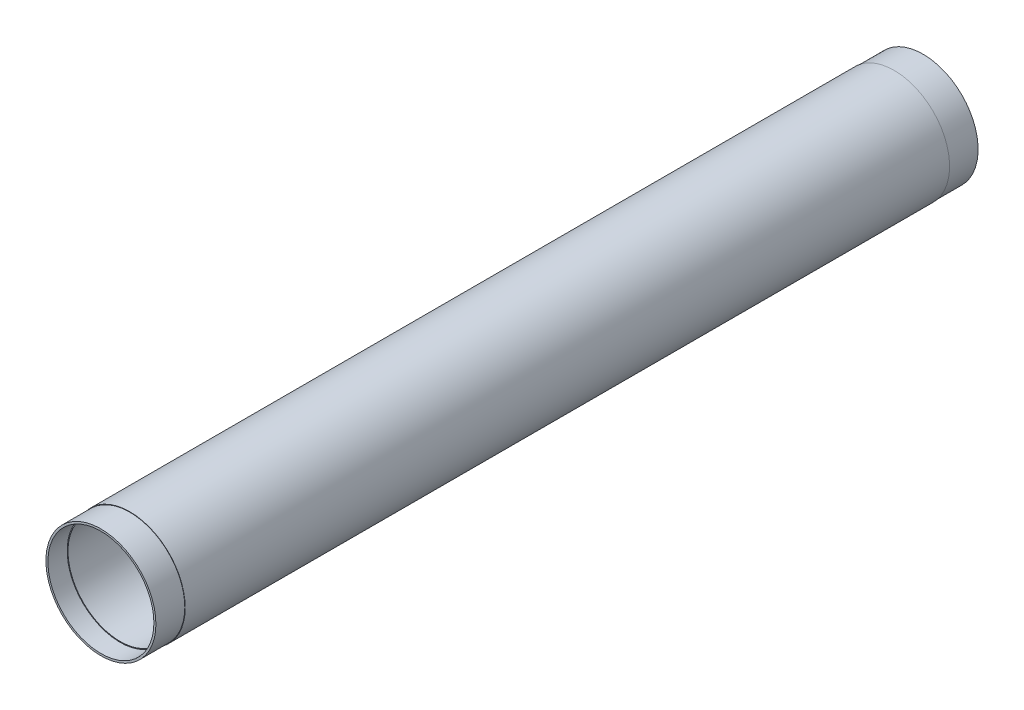
from build123d import *

# Parameters (mm, degrees)
SKETCH1_R           = 34.5
SKETCH1_R_2         = 32.5
BOSS_EXTRUDE1_DEPTH = 512
CUT_EXTRUDE1_START  = -12
SKETCH3_R           = 33
SKETCH3_R_2         = 32.5
CUT_EXTRUDE1_DEPTH  = 12
CUT_EXTRUDE3_START  = -18
SKETCH4_R           = 34.5
SKETCH4_R_2         = 34.25
CUT_EXTRUDE3_DEPTH  = 18
SKETCH5_R           = 34.5
SKETCH5_R_2         = 34.25
CUT_EXTRUDE4_DEPTH  = 18


with BuildPart() as part:
    # Sketch1 → Boss-Extrude1 (new body)
    with BuildSketch(Plane.XY):
        Circle(SKETCH1_R)
        Circle(SKETCH1_R_2, mode=Mode.SUBTRACT)
    extrude(amount=BOSS_EXTRUDE1_DEPTH)

    # Sketch3 → Cut-Extrude1 (cut)
    with BuildSketch(Plane.XY.offset(512).offset(CUT_EXTRUDE1_START)):
        Circle(SKETCH3_R)
        Circle(SKETCH3_R_2, mode=Mode.SUBTRACT)
    extrude(amount=CUT_EXTRUDE1_DEPTH, mode=Mode.SUBTRACT)

    # Sketch4 → Cut-Extrude3 (cut)
    with BuildSketch(Plane.XY.offset(512).offset(CUT_EXTRUDE3_START)):
        Circle(SKETCH4_R)
        Circle(SKETCH4_R_2, mode=Mode.SUBTRACT)
    extrude(amount=CUT_EXTRUDE3_DEPTH, mode=Mode.SUBTRACT)

    # Sketch5 → Cut-Extrude4 (cut)
    with BuildSketch(Plane(origin=(0, 0, 0), x_dir=(-1, 0, 0), z_dir=(0, 0, -1))):
        Circle(SKETCH5_R)
        Circle(SKETCH5_R_2, mode=Mode.SUBTRACT)
    extrude(amount=-CUT_EXTRUDE4_DEPTH, mode=Mode.SUBTRACT)


solid = part.part
